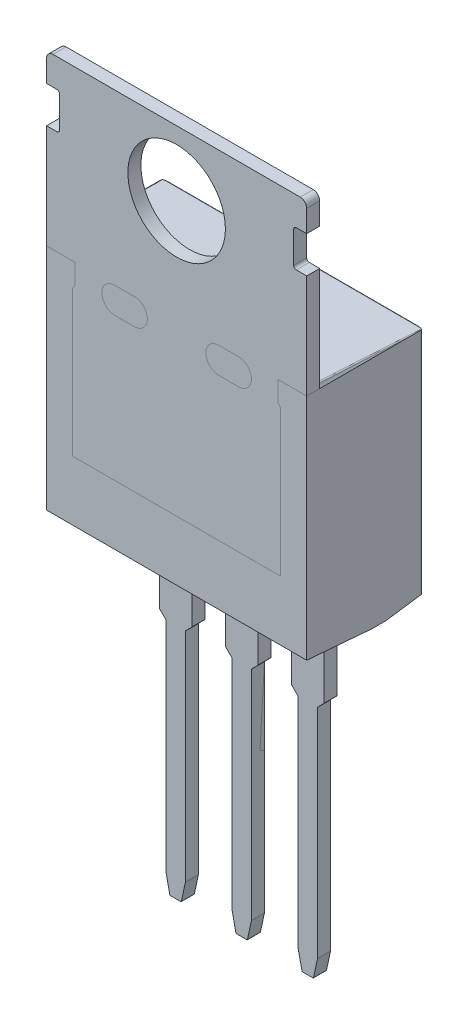
from build123d import *

# Parameters (mm, degrees)
SKETCH1_W               = 4.5
SKETCH1_H               = 9
BOSS_EXTRUDE1_DEPTH     = 5
CUT_EXTRUDE1_DEPTH      = 0.5
BOSS_EXTRUDE5_DEPTH     = 4.9
FILLET5_R               = 0.5
FILLET6_R               = 0.05
CUT_EXTRUDE2_DEPTH      = 12.25642999
CUT_EXTRUDE2_DEPTH_BACK = 12.25642999
BOSS_EXTRUDE3_DEPTH     = 0.5
FILLET2_R               = 0.02
SKETCH3_R               = 1.875
BOSS_EXTRUDE2_DEPTH     = 0.5
FILLET1_R               = 0.25
LPATTERN1_START         = -0.75
LPATTERN1_DEPTH         = 0.5
FILLET7_SIZE            = 0.5
FILLET7_SIZE_2          = 0.1
FILLET9_R               = 0.05
BOSS_EXTRUDE9_DEPTH     = 0.0005
BOSS_EXTRUDE9_2_DEPTH   = 0.0005
BOSS_EXTRUDE9_3_DEPTH   = 0.0005
BOSS_EXTRUDE9_4_DEPTH   = 0.0005
BOSS_EXTRUDE9_5_DEPTH   = 0.0005
SKETCH12_W              = 0.5
SKETCH12_H              = 1.40625
CUT_EXTRUDE3_DEPTH      = 19.403537244
FILLET10_R              = 0.1


with BuildPart() as part:
    # Sketch1 → Boss-Extrude1 (new, symmetric)
    with BuildSketch(Plane(origin=(0, 0, 0), x_dir=(0, 0, -1), z_dir=(1, 0, 0))):
        Rectangle(SKETCH1_W, SKETCH1_H)
    extrude(amount=BOSS_EXTRUDE1_DEPTH, both=True)

    # Sketch2 → Cut-Extrude1 (cut)
    with BuildSketch(Plane.XY.offset(2.25)):
        Polygon((-4, -2), (4, -2), (4, 3.589314856), (3.9, 3.738565289), (3.9, 4.5), (3.9, 5.586504107), (-3.9, 5.586504107), (-3.9, 4.5), (-3.9, 3.738565289), (-4, 3.589314856), align=None)
        with BuildLine():
            Line((-2.375, 4.5), (-1.625, 4.5))
            ThreePointArc((-1.625, 4.5), (-1.125, 4), (-1.625, 3.5))
            Line((-1.625, 3.5), (-2.375, 3.5))
            ThreePointArc((-2.375, 3.5), (-2.875, 4), (-2.375, 4.5))
        make_face(mode=Mode.SUBTRACT)
        with BuildLine():
            Line((2.375, 4.5), (1.625, 4.5))
            ThreePointArc((1.625, 4.5), (1.125, 4), (1.625, 3.5))
            Line((1.625, 3.5), (2.375, 3.5))
            ThreePointArc((2.375, 3.5), (2.875, 4), (2.375, 4.5))
        make_face(mode=Mode.SUBTRACT)
    extrude(amount=-CUT_EXTRUDE1_DEPTH, mode=Mode.SUBTRACT)

    # Sketch6 → Boss-Extrude5 (add, symmetric)
    with BuildSketch(Plane(origin=(0, 0, 0), x_dir=(0, 0, -1), z_dir=(1, 0, 0))):
        Polygon((2.25, 4.5), (-1.75, 4.652387837), (-1.75, 4.5), align=None)
    extrude(amount=BOSS_EXTRUDE5_DEPTH, both=True)

    # Fillet5
    # the kernel refuses this fillet: 0.5 mm, written as the material it adds along each edge
    with BuildSketch(Plane(origin=(-4.9, 4.5, 1.75), x_dir=(-1, 0, 0), z_dir=(0, 0, -1))) as fillet5_piece_1_section:
        with BuildLine():
            CenterArc((0.5, 0.3), FILLET5_R, 180, 36.869897646)
            Line((0, 0.3), (0, 0))
            Line((0, 0), (0.1, 0))
        make_face()
    fillet5_piece_1 = extrude(amount=4.75, mode=Mode.PRIVATE)
    fillet5_piece_1 = split(fillet5_piece_1, bisect_by=Plane(origin=(-4.9, 4.652166985, 1.744202901), z_dir=(0, -0.9992750998282863, 0.03806934282554173)), keep=Keep.TOP, mode=Mode.PRIVATE)
    add(fillet5_piece_1)
    with BuildSketch(Plane(origin=(4.9, 4.5, 1.75), x_dir=(1, 0, 0), z_dir=(0, 0, -1))) as fillet5_piece_2_section:
        with BuildLine():
            CenterArc((0.5, -0.3), FILLET5_R, 143.130102354, 36.869897646)
            Line((0, -0.3), (0, 0))
            Line((0, 0), (0.1, 0))
        make_face()
    fillet5_piece_2 = extrude(amount=4.75, mode=Mode.PRIVATE)
    fillet5_piece_2 = split(fillet5_piece_2, bisect_by=Plane(origin=(4.9, 4.652166985, 1.744202901), z_dir=(0, -0.9992750998282863, 0.03806934282554173)), keep=Keep.TOP, mode=Mode.PRIVATE)
    add(fillet5_piece_2)

    # Fillet6
    fillet6_edges = [part.edges().sort_by_distance(p)[0] for p in [
        (-4.952889184, 4.57618776, -0.250161646),
        (4.952889184, 4.57618776, -0.250161646),
    ]]
    fillet(fillet6_edges, radius=FILLET6_R)

    # Sketch7 → Cut-Extrude2 (cut, two sides: drawn at the far end of the back side and taken through both)
    with BuildSketch(Plane(origin=(5, 0, 0), x_dir=(0, 0, -1), z_dir=(1, 0, 0)).offset(-CUT_EXTRUDE2_DEPTH_BACK)):
        Polygon((0.25, -4.5), (-2.25, -4.5), (-2.25, -4.295400549), align=None)
        Polygon((2.25, -4.5), (0.8, -4.5), (2.25, -4.295400549), align=None)
    extrude(amount=CUT_EXTRUDE2_DEPTH + CUT_EXTRUDE2_DEPTH_BACK, mode=Mode.SUBTRACT)

    # LPattern1: read off the stored shape, not the designer's step
    # LPattern1 outline → LPattern1 (add)
    with BuildSketch(Plane.XY.offset(LPATTERN1_START)):
        with BuildLine():
            Line((3.208197623, -4.5), (1.871802377, -4.5))
            Line((1.871802377, -4.5), (1.871802377, -5.48))
            ThreePointArc((1.871802377, -5.48), (1.877660241, -5.494142136), (1.891802377, -5.5))
            Line((1.891802377, -5.5), (1.895, -5.5))
            ThreePointArc((1.895, -5.5), (1.909142136, -5.505857864), (1.915, -5.52))
            Line((1.915, -5.52), (1.915, -7.891715729))
            ThreePointArc((1.915, -7.891715729), (1.916522409, -7.899369397), (1.920857864, -7.905857864))
            Line((1.920857864, -7.905857864), (2.159142136, -8.144142136))
            ThreePointArc((2.159142136, -8.144142136), (2.163477591, -8.150630603), (2.165, -8.158284271))
            Line((2.165, -8.158284271), (2.165, -16.516578995))
            ThreePointArc((2.165, -16.516578995), (2.165111122, -16.51868435), (2.165443252, -16.52076631))
            Line((2.165443252, -16.52076631), (2.318194539, -17.234187315))
            ThreePointArc((2.318194539, -17.234187315), (2.325176437, -17.245552272), (2.337751287, -17.25))
            Line((2.337751287, -17.25), (2.742248713, -17.25))
            ThreePointArc((2.742248713, -17.25), (2.754823563, -17.245552272), (2.761805461, -17.234187315))
            Line((2.761805461, -17.234187315), (2.914556748, -16.52076631))
            ThreePointArc((2.914556748, -16.52076631), (2.914888878, -16.51868435), (2.915, -16.516578995))
            Line((2.915, -16.516578995), (2.915, -8.158284271))
            ThreePointArc((2.915, -8.158284271), (2.916522409, -8.150630603), (2.920857864, -8.144142136))
            Line((2.920857864, -8.144142136), (3.159142136, -7.905857864))
            ThreePointArc((3.159142136, -7.905857864), (3.163477591, -7.899369397), (3.165, -7.891715729))
            Line((3.165, -7.891715729), (3.165, -5.52))
            ThreePointArc((3.165, -5.52), (3.170857864, -5.505857864), (3.185, -5.5))
            Line((3.185, -5.5), (3.188197623, -5.5))
            ThreePointArc((3.188197623, -5.5), (3.202339759, -5.494142136), (3.208197623, -5.48))
            Line((3.208197623, -5.48), (3.208197623, -4.5))
        make_face()
        with BuildLine():
            Line((0.668197623, -4.5), (-0.668197623, -4.5))
            Line((-0.668197623, -4.5), (-0.668197623, -5.48))
            ThreePointArc((-0.668197623, -5.48), (-0.662339759, -5.494142136), (-0.648197623, -5.5))
            Line((-0.648197623, -5.5), (-0.645, -5.5))
            ThreePointArc((-0.645, -5.5), (-0.630857864, -5.505857864), (-0.625, -5.52))
            Line((-0.625, -5.52), (-0.625, -7.891715729))
            ThreePointArc((-0.625, -7.891715729), (-0.623477591, -7.899369397), (-0.619142136, -7.905857864))
            Line((-0.619142136, -7.905857864), (-0.380857864, -8.144142136))
            ThreePointArc((-0.380857864, -8.144142136), (-0.376522409, -8.150630603), (-0.375, -8.158284271))
            Line((-0.375, -8.158284271), (-0.375, -16.516578995))
            ThreePointArc((-0.375, -16.516578995), (-0.374888878, -16.51868435), (-0.374556748, -16.52076631))
            Line((-0.374556748, -16.52076631), (-0.221805461, -17.234187315))
            ThreePointArc((-0.221805461, -17.234187315), (-0.214823563, -17.245552272), (-0.202248713, -17.25))
            Line((-0.202248713, -17.25), (0.202248713, -17.25))
            ThreePointArc((0.202248713, -17.25), (0.214823563, -17.245552272), (0.221805461, -17.234187315))
            Line((0.221805461, -17.234187315), (0.374556748, -16.52076631))
            ThreePointArc((0.374556748, -16.52076631), (0.374888878, -16.51868435), (0.375, -16.516578995))
            Line((0.375, -16.516578995), (0.375, -8.158284271))
            ThreePointArc((0.375, -8.158284271), (0.376522409, -8.150630603), (0.380857864, -8.144142136))
            Line((0.380857864, -8.144142136), (0.619142136, -7.905857864))
            ThreePointArc((0.619142136, -7.905857864), (0.623477591, -7.899369397), (0.625, -7.891715729))
            Line((0.625, -7.891715729), (0.625, -5.52))
            ThreePointArc((0.625, -5.52), (0.630857864, -5.505857864), (0.645, -5.5))
            Line((0.645, -5.5), (0.648197623, -5.5))
            ThreePointArc((0.648197623, -5.5), (0.662339759, -5.494142136), (0.668197623, -5.48))
            Line((0.668197623, -5.48), (0.668197623, -4.5))
        make_face()
        with BuildLine():
            Line((-2.915, -8.158284271), (-2.915, -16.516578995))
            ThreePointArc((-2.915, -16.516578995), (-2.914888878, -16.51868435), (-2.914556748, -16.52076631))
            Line((-2.914556748, -16.52076631), (-2.761805461, -17.234187315))
            ThreePointArc((-2.761805461, -17.234187315), (-2.754823563, -17.245552272), (-2.742248713, -17.25))
            Line((-2.742248713, -17.25), (-2.337751287, -17.25))
            ThreePointArc((-2.337751287, -17.25), (-2.325176437, -17.245552272), (-2.318194539, -17.234187315))
            Line((-2.318194539, -17.234187315), (-2.165443252, -16.52076631))
            ThreePointArc((-2.165443252, -16.52076631), (-2.165111122, -16.51868435), (-2.165, -16.516578995))
            Line((-2.165, -16.516578995), (-2.165, -8.158284271))
            ThreePointArc((-2.165, -8.158284271), (-2.163477591, -8.150630603), (-2.159142136, -8.144142136))
            Line((-2.159142136, -8.144142136), (-1.920857864, -7.905857864))
            ThreePointArc((-1.920857864, -7.905857864), (-1.916522409, -7.899369397), (-1.915, -7.891715729))
            Line((-1.915, -7.891715729), (-1.915, -5.52))
            ThreePointArc((-1.915, -5.52), (-1.909142136, -5.505857864), (-1.895, -5.5))
            Line((-1.895, -5.5), (-1.891802377, -5.5))
            ThreePointArc((-1.891802377, -5.5), (-1.877660241, -5.494142136), (-1.871802377, -5.48))
            Line((-1.871802377, -5.48), (-1.871802377, -4.5))
            Line((-1.871802377, -4.5), (-3.208197623, -4.5))
            Line((-3.208197623, -4.5), (-3.208197623, -5.48))
            ThreePointArc((-3.208197623, -5.48), (-3.202339759, -5.494142136), (-3.188197623, -5.5))
            Line((-3.188197623, -5.5), (-3.185, -5.5))
            ThreePointArc((-3.185, -5.5), (-3.170857864, -5.505857864), (-3.165, -5.52))
            Line((-3.165, -5.52), (-3.165, -7.891715729))
            ThreePointArc((-3.165, -7.891715729), (-3.163477591, -7.899369397), (-3.159142136, -7.905857864))
            Line((-3.159142136, -7.905857864), (-2.920857864, -8.144142136))
            ThreePointArc((-2.920857864, -8.144142136), (-2.916522409, -8.150630603), (-2.915, -8.158284271))
        make_face()
    extrude(amount=LPATTERN1_DEPTH)

    # Fillet7
    # a fillet whose section is not a circle: 0.5, 0.1 mm, written as the material it takes off along each edge
    with BuildSketch(Plane(origin=(-5, -5.545400549, -2.25), x_dir=(1, 0, 0), z_dir=(0, 1, 0))) as fillet7_piece_1:
        with BuildLine():
            Bezier((FILLET7_SIZE, 0), (0, 0), (0, -FILLET7_SIZE_2), weights=[1, 0.707106781, 1])
            Line((0, -FILLET7_SIZE_2), (0, 0))
            Line((0, 0), (FILLET7_SIZE, 0))
        make_face()
    extrude(amount=11.289108142, mode=Mode.SUBTRACT)
    with BuildSketch(Plane(origin=(5, -5.545400549, -2.25), x_dir=(0, 0, 1), z_dir=(0, 1, 0))) as fillet7_piece_2:
        with BuildLine():
            Bezier((FILLET7_SIZE_2, 0), (0, 0), (0, -FILLET7_SIZE), weights=[1, 0.707106781, 1])
            Line((0, -FILLET7_SIZE), (0, 0))
            Line((0, 0), (FILLET7_SIZE_2, 0))
        make_face()
    extrude(amount=11.289108142, mode=Mode.SUBTRACT)

    # Fillet9
    # the kernel refuses this fillet: 0.05 mm, written as the material it takes off along each edge
    with BuildSketch(Plane(origin=(5.101642792, 4.5, -2.25), x_dir=(2.542151763486406e-12, 0.03806934280621304, 0.9992750998290226), z_dir=(-1.0, 0, 2.543958310001694e-12))) as fillet9_piece_1:
        with BuildLine():
            CenterArc((FILLET9_R * 0.962628466484, -FILLET9_R), FILLET9_R, 90.000000001, 87.818260121)
            Line((-FILLET9_R * 0.0366466333446, -FILLET9_R * 0.961930657194), (0, 0))
            Line((0, 0), (FILLET9_R * 0.962628466465, 0))
        make_face()
    extrude(amount=10.203285583, mode=Mode.SUBTRACT)


with BuildPart() as body_2:
    # Sketch4 → Boss-Extrude3 (new body)
    with BuildSketch(Plane(origin=(0, 0, -0.25), x_dir=(-1, 0, 0), z_dir=(0, 0, -1))):
        Polygon((-0.668197623, -4.5), (0.668197623, -4.5), (0.668197623, -5.5), (0.625, -5.5), (0.625, -7.9), (0.375, -8.15), (0.375, -16.518696112), (0.218419791, -17.25), (-0.218419791, -17.25), (-0.375, -16.518696112), (-0.375, -8.15), (-0.625, -7.9), (-0.625, -5.5), (-0.668197623, -5.5), align=None)
    extrude(amount=BOSS_EXTRUDE3_DEPTH)

    # Fillet2
    fillet2_edges = [body_2.edges().sort_by_distance(p)[0] for p in [
        (-0.375, -16.518696112, -0.5),
        (-0.218419791, -17.25, -0.5),
        (0.218419791, -17.25, -0.5),
        (0.375, -16.518696112, -0.5),
        (0.375, -8.15, -0.5),
        (0.625, -7.9, -0.5),
        (0.625, -5.5, -0.5),
        (0.668197623, -5.5, -0.5),
        (-0.668197623, -5.5, -0.5),
        (-0.625, -5.5, -0.5),
        (-0.625, -7.9, -0.5),
        (-0.375, -8.15, -0.5),
    ]]
    fillet(fillet2_edges, radius=FILLET2_R)


with BuildPart() as body_3:
    # Sketch3 → Boss-Extrude2 (new body)
    with BuildSketch(Plane.XY.offset(1.75)):
        Polygon((-5, 4.5), (-5, 11), (5, 11), (5, 4.5), (3.9, 4.5), (3.9, 3.738565289), (4, 3.589314856), (4, -2), (-4, -2), (-4, 3.589314856), (-3.9, 3.738565289), (-3.9, 4.5), align=None)
        with Locations((0, 8.5)):
            Circle(SKETCH3_R, mode=Mode.SUBTRACT)
        with BuildLine():
            Line((2.375, 4.5), (1.625, 4.5))
            ThreePointArc((1.625, 4.5), (1.125, 4), (1.625, 3.5))
            Line((1.625, 3.5), (2.375, 3.5))
            ThreePointArc((2.375, 3.5), (2.875, 4), (2.375, 4.5))
        make_face(mode=Mode.SUBTRACT)
        with BuildLine():
            Line((-2.375, 3.5), (-1.625, 3.5))
            ThreePointArc((-1.625, 3.5), (-1.125, 4), (-1.625, 4.5))
            Line((-1.625, 4.5), (-2.375, 4.5))
            ThreePointArc((-2.375, 4.5), (-2.875, 4), (-2.375, 3.5))
        make_face(mode=Mode.SUBTRACT)
    extrude(amount=BOSS_EXTRUDE2_DEPTH)

    # Fillet1
    fillet1_edges = [body_3.edges().sort_by_distance(p)[0] for p in [
        (-5, 11, 2),
        (5, 11, 2),
    ]]
    fillet(fillet1_edges, radius=FILLET1_R)

    # Sketch12 → Cut-Extrude3 (cut, through all)
    with BuildSketch(Plane(origin=(0, 0, 1.75), x_dir=(-1, 0, 0), z_dir=(0, 0, -1))):
        with Locations((4.75, 9.203125)):
            Rectangle(SKETCH12_W, SKETCH12_H)
        with Locations((-4.75, 9.203125)):
            Rectangle(SKETCH12_W, SKETCH12_H)
    extrude(amount=-CUT_EXTRUDE3_DEPTH, mode=Mode.SUBTRACT)

    # Fillet10
    fillet10_edges = [body_3.edges().sort_by_distance(p)[0] for p in [
        (4.5, 9.90625, 2),
        (4.5, 8.5, 2),
        (-4.5, 8.5, 2),
        (-4.5, 9.90625, 2),
    ]]
    fillet(fillet10_edges, radius=FILLET10_R)


with BuildPart() as body_4:
    # Sketch11 → Boss-Extrude9 (new body)
    with BuildSketch(Plane(origin=(0, 0, -2.25), x_dir=(-1, 0, 0), z_dir=(0, 0, -1))):
        Polygon((-3.723080955, -1.488315738), (-3.723080955, 0.052675473), (-3.505761682, 0.052675473), (-3.505761682, -1.31050906), (-2.774778672, -1.31050906), (-2.774778672, -1.488315738), align=None)
    extrude(amount=BOSS_EXTRUDE9_DEPTH)


with BuildPart() as body_5:
    # Sketch11 → Boss-Extrude9 2 (new body)
    with BuildSketch(Plane(origin=(0, 0, -2.25), x_dir=(-1, 0, 0), z_dir=(0, 0, -1))):
        with BuildLine():
            Line((-2.292725011, -1.488315738), (-2.292725011, 0.052675473))
            Line((-2.292725011, 0.052675473), (-1.965820024, 0.052675473))
            Line((-1.965820024, 0.052675473), (-1.621319585, -1.028673127))
            add(Edge.make_bspline(
                [(-1.621319585, -1.028673127), (-1.617528343, -1.040922922), (-1.610196302, -1.064613313), (-1.599323755, -1.098824417), (-1.58943156, -1.13061597), (-1.58052208, -1.160089165), (-1.572114089, -1.187097671), (-1.564834094, -1.211863111), (-1.557874181, -1.234110287), (-1.553795361, -1.248249094), (-1.551863852, -1.254944473)],
                knots=[0, 0, 0, 0, 1.300204174, 2.514519184, 3.639827924, 4.676153899, 5.636536826, 6.507959918, 7.293450077, 8, 8, 8, 8], degree=3))
            add(Edge.make_bspline(
                [(-1.551863852, -1.254944473), (-1.549712599, -1.247635881), (-1.545134594, -1.232082732), (-1.537712917, -1.20762807), (-1.529816042, -1.180566235), (-1.520365903, -1.151362376), (-1.510515251, -1.119558375), (-1.50017571, -1.085180645), (-1.48824925, -1.048572407), (-1.480323522, -1.023227961), (-1.476234275, -1.010151598)],
                knots=[0, 0, 0, 0, 0.713638162, 1.518667645, 2.393860736, 3.354087503, 4.393659122, 5.512594909, 6.716633584, 8, 8, 8, 8], degree=3))
            Line((-1.476234275, -1.010151598), (-1.13512945, 0.052675473))
            Line((-1.13512945, 0.052675473), (-0.811002693, 0.052675473))
            Line((-0.811002693, 0.052675473), (-0.811002693, -1.488315738))
            Line((-0.811002693, -1.488315738), (-1.028321966, -1.488315738))
            Line((-1.028321966, -1.488315738), (-1.028321966, -0.184400098))
            Line((-1.028321966, -0.184400098), (-1.439499909, -1.488315738))
            Line((-1.439499909, -1.488315738), (-1.666697331, -1.488315738))
            Line((-1.666697331, -1.488315738), (-2.075405738, -0.184400098))
            Line((-2.075405738, -0.184400098), (-2.075405738, -1.488315738))
            Line((-2.075405738, -1.488315738), (-2.292725011, -1.488315738))
        make_face()
    extrude(amount=BOSS_EXTRUDE9_2_DEPTH)


with BuildPart() as body_6:
    # Sketch11 → Boss-Extrude9 3 (new body)
    with BuildSketch(Plane(origin=(0, 0, -2.25), x_dir=(-1, 0, 0), z_dir=(0, 0, -1))):
        with BuildLine():
            Line((-0.289436437, -1.073433489), (-0.091873461, -1.053677191))
            add(Edge.make_bspline(
                [(-0.091873461, -1.053677191), (-0.08923971, -1.065547945), (-0.084143597, -1.088516972), (-0.074338053, -1.121422491), (-0.063981246, -1.15196617), (-0.051141972, -1.179464821), (-0.038613631, -1.205043025), (-0.023890934, -1.227643915), (-0.008159446, -1.247857177), (0.008871656, -1.265607756), (0.027398623, -1.280893172), (0.04717445, -1.294268736), (0.068617378, -1.305439133), (0.091563235, -1.314283364), (0.115818762, -1.321442845), (0.141515774, -1.326699922), (0.168790154, -1.329831628), (0.187484528, -1.330118422), (0.197062391, -1.330265357)],
                knots=[0, 0, 0, 0, 1.321063709, 2.556160278, 3.730472002, 4.821700466, 5.852032229, 6.822994757, 7.746964065, 8.632786469, 9.490489437, 10.352773447, 11.223141997, 12.11199479, 13.021433979, 13.96892724, 14.959401504, 16, 16, 16, 16], degree=3))
            add(Edge.make_bspline(
                [(0.197062391, -1.330265357), (0.208296885, -1.330105181), (0.23023787, -1.329792355), (0.262209504, -1.325098781), (0.292636152, -1.318654056), (0.321083706, -1.308548359), (0.347948282, -1.296197328), (0.373076833, -1.280934075), (0.396641361, -1.263011196), (0.418177072, -1.242306778), (0.437436406, -1.219531258), (0.454589549, -1.195474497), (0.468772893, -1.169931225), (0.480727316, -1.143261226), (0.489551244, -1.115033526), (0.496011072, -1.08560011), (0.500232602, -1.054827869), (0.500618512, -1.033832135), (0.500815466, -1.023116668)],
                knots=[0, 0, 0, 0, 1.111377895, 2.170522867, 3.193923215, 4.186422864, 5.152846954, 6.117443035, 7.091571248, 8.078879332, 9.069127402, 10.041602243, 10.999610288, 11.957618333, 12.930786866, 13.922135183, 14.939532534, 16, 16, 16, 16], degree=3))
            add(Edge.make_bspline(
                [(0.500815466, -1.023116668), (0.500583987, -1.012919265), (0.500131116, -0.992968858), (0.496408152, -0.963685941), (0.489911661, -0.935888555), (0.480905973, -0.909415825), (0.469398551, -0.884306617), (0.455566969, -0.860353299), (0.43864981, -0.838080811), (0.419608056, -0.817249926), (0.398839057, -0.798058704), (0.376110579, -0.7817341), (0.352191677, -0.767645434), (0.326797294, -0.756269388), (0.300032868, -0.747240155), (0.271923913, -0.740750668), (0.242335289, -0.737026088), (0.222179885, -0.736573138), (0.211879614, -0.736341661)],
                knots=[0, 0, 0, 0, 1.072815875, 2.098878726, 3.09954706, 4.07199174, 5.036203424, 6.001873089, 6.97636515, 7.972747947, 8.969130744, 9.945905975, 10.911575641, 11.885646534, 12.868345115, 13.879560892, 14.916365174, 16, 16, 16, 16], degree=3))
            add(Edge.make_bspline(
                [(0.211879614, -0.736341661), (0.202810851, -0.736581921), (0.183564822, -0.737091809), (0.153188148, -0.741593927), (0.119540836, -0.747897947), (0.096289582, -0.754084407), (0.084081064, -0.757332727)],
                knots=[0, 0, 0, 0, 0.837610211, 1.777604146, 2.833088267, 4, 4, 4, 4], degree=3))
            Line((0.084081064, -0.757332727), (0.104454746, -0.579526049))
            add(Edge.make_bspline(
                [(0.104454746, -0.579526049), (0.109800324, -0.580110175), (0.11924412, -0.581142124), (0.128735539, -0.58152203), (0.132854424, -0.581686894)],
                knots=[0, 0, 0, 0, 1.132082448, 2, 2, 2, 2], degree=3))
            add(Edge.make_bspline(
                [(0.132854424, -0.581686894), (0.151023675, -0.580993199), (0.186666035, -0.579632388), (0.238625687, -0.568325183), (0.287868197, -0.550522355), (0.325911218, -0.529280998), (0.354122636, -0.509302348), (0.371912189, -0.491288761), (0.387950389, -0.472172706), (0.399916197, -0.450245899), (0.410253917, -0.426948136), (0.416655527, -0.401361658), (0.421324104, -0.374108405), (0.421632095, -0.355232062), (0.421790276, -0.3455374)],
                knots=[0, 0, 0, 0, 1.557468908, 3.055264441, 4.54122591, 6.035034992, 6.780215604, 7.498173296, 8.201377046, 8.913174237, 9.633083494, 10.382644491, 11.169345745, 12, 12, 12, 12], degree=3))
            add(Edge.make_bspline(
                [(0.421790276, -0.3455374), (0.421644287, -0.337706695), (0.421358773, -0.322392044), (0.418178023, -0.299939149), (0.412917452, -0.27866434), (0.405807268, -0.258340459), (0.396488666, -0.239074022), (0.384932867, -0.220888615), (0.371729975, -0.203415331), (0.356144428, -0.187557076), (0.33945366, -0.17266853), (0.321049026, -0.16012932), (0.30180645, -0.148990076), (0.281047289, -0.140572669), (0.259284039, -0.133652188), (0.236330665, -0.128802595), (0.212178788, -0.125545769), (0.195633015, -0.125271338), (0.187184242, -0.125131205)],
                knots=[0, 0, 0, 0, 1.041493611, 2.036867705, 3.009952345, 3.954088258, 4.897230656, 5.850851638, 6.817653571, 7.805463921, 8.805067469, 9.788883576, 10.763797054, 11.758134544, 12.762883247, 13.799594994, 14.876406454, 16, 16, 16, 16], degree=3))
            add(Edge.make_bspline(
                [(0.187184242, -0.125131205), (0.170650207, -0.125775894), (0.138720533, -0.127020885), (0.093006317, -0.138539631), (0.051580982, -0.15717846), (0.020911662, -0.179036603), (-0.000866252, -0.199934225), (-0.015741721, -0.217647369), (-0.029046985, -0.237207846), (-0.040819754, -0.258608683), (-0.050900973, -0.281935947), (-0.059988913, -0.306900647), (-0.067023822, -0.33390247), (-0.070390602, -0.352612071), (-0.072117163, -0.362206776)],
                knots=[0, 0, 0, 0, 1.533565899, 2.961543033, 4.347411787, 5.731829577, 6.434842101, 7.147085226, 7.87612511, 8.629021686, 9.412189982, 10.234506416, 11.094615066, 12, 12, 12, 12], degree=3))
            Line((-0.072117163, -0.362206776), (-0.269680139, -0.342450478))
            add(Edge.make_bspline(
                [(-0.269680139, -0.342450478), (-0.266589664, -0.327174694), (-0.260527455, -0.297210041), (-0.248176761, -0.253932916), (-0.233115241, -0.21330802), (-0.215031356, -0.175521609), (-0.194779446, -0.14012147), (-0.171417398, -0.107527503), (-0.145492937, -0.077545932), (-0.116960012, -0.050268206), (-0.086205977, -0.025906146), (-0.053385729, -0.004890672), (-0.018768614, 0.012922971), (0.01767778, 0.027283918), (0.055924596, 0.038961544), (0.096080644, 0.046698001), (0.137964164, 0.051931324), (0.166485135, 0.052424372), (0.181010399, 0.052675473)],
                knots=[0, 0, 0, 0, 1.136581168, 2.229493434, 3.279335563, 4.293305329, 5.282068175, 6.250623624, 7.213783178, 8.169396253, 9.125981663, 10.071280146, 11.007896369, 11.961295906, 12.925420184, 13.920544621, 14.940967302, 16, 16, 16, 16], degree=3))
            add(Edge.make_bspline(
                [(0.181010399, 0.052675473), (0.201116824, 0.052023471), (0.240652554, 0.050741425), (0.298721329, 0.040559257), (0.354263807, 0.023850116), (0.406833041, 0.000688267), (0.455524605, -0.027614901), (0.498612625, -0.061534524), (0.535521074, -0.1004838), (0.565533086, -0.144036901), (0.58929839, -0.190407939), (0.606884, -0.238543087), (0.617391666, -0.288386934), (0.61869806, -0.322131206), (0.619353252, -0.339054865)],
                knots=[0, 0, 0, 0, 1.104647871, 2.172094857, 3.229560912, 4.285649672, 5.322588163, 6.317201348, 7.289435229, 8.260615662, 9.214246199, 10.146367077, 11.070353327, 12, 12, 12, 12], degree=3))
            add(Edge.make_bspline(
                [(0.619353252, -0.339054865), (0.618689018, -0.355052747), (0.617377521, -0.386639799), (0.607280543, -0.432825665), (0.590218658, -0.476581579), (0.567157397, -0.518061062), (0.537252598, -0.556367086), (0.500586403, -0.590501244), (0.457745374, -0.62079015), (0.425639645, -0.636555191), (0.409133898, -0.644660093)],
                knots=[0, 0, 0, 0, 0.975609618, 1.926294443, 2.868398979, 3.832526731, 4.812148358, 5.820404151, 6.879456693, 8, 8, 8, 8], degree=3))
            add(Edge.make_bspline(
                [(0.409133898, -0.644660093), (0.4201999, -0.64745404), (0.441874969, -0.652926566), (0.473005284, -0.664265485), (0.502271274, -0.677540507), (0.530062452, -0.692576032), (0.555571987, -0.710357978), (0.579679171, -0.729800519), (0.601472696, -0.751840023), (0.621583959, -0.775690962), (0.63988274, -0.801103733), (0.655281343, -0.82857267), (0.66856989, -0.857375664), (0.679901099, -0.887721622), (0.688043681, -0.919844535), (0.693865884, -0.953495544), (0.697708063, -0.988557737), (0.698152792, -1.012508049), (0.698378442, -1.024660129)],
                knots=[0, 0, 0, 0, 1.053251915, 2.063013066, 3.05373318, 4.018979697, 4.975584284, 5.920798056, 6.874756953, 7.832116109, 8.799604348, 9.761196922, 10.734637845, 11.72654167, 12.747371341, 13.789206138, 14.878271633, 16, 16, 16, 16], degree=3))
            add(Edge.make_bspline(
                [(0.698378442, -1.024660129), (0.698002428, -1.041250641), (0.69726344, -1.073856322), (0.690257807, -1.121754809), (0.678809031, -1.167647998), (0.662965461, -1.211691736), (0.642889151, -1.254065771), (0.617696693, -1.294172135), (0.588134734, -1.332336837), (0.554665434, -1.368194465), (0.517996613, -1.401148728), (0.478175676, -1.42968397), (0.435990478, -1.453916547), (0.391372369, -1.473678093), (0.34443963, -1.489203836), (0.295145573, -1.500333184), (0.243337659, -1.506874016), (0.207988342, -1.50766744), (0.189962472, -1.508072035)],
                knots=[0, 0, 0, 0, 1.016055063, 1.996874249, 2.958724482, 3.910019225, 4.860394196, 5.826121543, 6.806008102, 7.814207964, 8.82789325, 9.821757317, 10.810247154, 11.803791187, 12.806673825, 13.834534493, 14.895752369, 16, 16, 16, 16], degree=3))
            add(Edge.make_bspline(
                [(0.189962472, -1.508072035), (0.173785749, -1.507767332), (0.141939279, -1.507167474), (0.095322623, -1.500917974), (0.050661442, -1.492049216), (0.008308894, -1.47837696), (-0.032226985, -1.461703864), (-0.070259664, -1.440373154), (-0.106472999, -1.415886325), (-0.140187131, -1.387543783), (-0.171214826, -1.356261024), (-0.198895242, -1.322500749), (-0.222664603, -1.286337914), (-0.243621954, -1.248313586), (-0.260560914, -1.207710985), (-0.273750576, -1.164878713), (-0.28380787, -1.119975732), (-0.287539834, -1.089116371), (-0.289436437, -1.073433489)],
                knots=[0, 0, 0, 0, 1.08471039, 2.135426191, 3.150939737, 4.135689946, 5.116584603, 6.086901885, 7.055842759, 8.045878862, 9.036901429, 10.008421467, 10.96965771, 11.936653536, 12.917548193, 13.915472582, 14.940632654, 16, 16, 16, 16], degree=3))
        make_face()
    extrude(amount=BOSS_EXTRUDE9_3_DEPTH)


with BuildPart() as body_7:
    # Sketch11 → Boss-Extrude9 4 (new body)
    with BuildSketch(Plane(origin=(0, 0, -2.25), x_dir=(-1, 0, 0), z_dir=(0, 0, -1))):
        with BuildLine():
            Line((1.871902518, -1.488315738), (1.674339542, -1.488315738))
            Line((1.674339542, -1.488315738), (1.674339542, -0.287503276))
            add(Edge.make_bspline(
                [(1.674339542, -0.287503276), (1.662963849, -0.298473733), (1.639320716, -0.321274625), (1.599354498, -0.353543582), (1.554747092, -0.386249537), (1.506077751, -0.417699969), (1.456467593, -0.447307159), (1.408525761, -0.473934275), (1.363052666, -0.496467276), (1.333099293, -0.50878841), (1.318726186, -0.514700698)],
                knots=[0, 0, 0, 0, 0.893362401, 1.856755847, 2.901947673, 4.020460078, 5.132200827, 6.168787962, 7.121294059, 8, 8, 8, 8], degree=3))
            Line((1.318726186, -0.514700698), (1.318726186, -0.33257233))
            add(Edge.make_bspline(
                [(1.318726186, -0.33257233), (1.343413483, -0.319858322), (1.392070683, -0.294799767), (1.460812786, -0.251520196), (1.524990934, -0.20460336), (1.583542723, -0.154059646), (1.636030672, -0.102394897), (1.680263029, -0.050263136), (1.71727385, 0.000424712), (1.73584288, 0.035773865), (1.744721352, 0.052675473)],
                knots=[0, 0, 0, 0, 1.141258006, 2.249351951, 3.335817539, 4.406819942, 5.426913362, 6.360259544, 7.215985427, 8, 8, 8, 8], degree=3))
            Line((1.744721352, 0.052675473), (1.871902518, 0.052675473))
            Line((1.871902518, 0.052675473), (1.871902518, -1.488315738))
        make_face()
    extrude(amount=BOSS_EXTRUDE9_4_DEPTH)


with BuildPart() as body_8:
    # Sketch11 → Boss-Extrude9 5 (new body)
    with BuildSketch(Plane(origin=(0, 0, -2.25), x_dir=(-1, 0, 0), z_dir=(0, 0, -1))):
        with BuildLine():
            Line((2.650300643, -0.1646438), (2.650300643, 0.032919176))
            Line((2.650300643, 0.032919176), (3.638115521, 0.032919176))
            Line((3.638115521, 0.032919176), (3.638115521, -0.126983358))
            add(Edge.make_bspline(
                [(3.638115521, -0.126983358), (3.626486362, -0.140582687), (3.602708817, -0.168388538), (3.568262187, -0.212678794), (3.533636565, -0.259832803), (3.49944057, -0.310303999), (3.465163243, -0.363724044), (3.43094254, -0.42026355), (3.396638759, -0.479784804), (3.351642468, -0.563126161), (3.297959572, -0.66982411), (3.242177946, -0.801295184), (3.192656755, -0.934076642), (3.166303824, -1.024380795), (3.153160154, -1.069420491)],
                knots=[0, 0, 0, 0, 0.603281671, 1.233499104, 1.891379699, 2.575603978, 3.288773649, 4.031381703, 4.80386477, 5.604951941, 7.224880277, 8.828980706, 10.418436603, 12, 12, 12, 12], degree=3))
            add(Edge.make_bspline(
                [(3.153160154, -1.069420491), (3.144635927, -1.101948195), (3.127294483, -1.168121624), (3.108310943, -1.270880579), (3.093633852, -1.378022269), (3.087870428, -1.451132407), (3.084939189, -1.488315738)],
                knots=[0, 0, 0, 0, 0.948866074, 1.930345965, 2.947387709, 4, 4, 4, 4], degree=3))
            Line((3.084939189, -1.488315738), (2.887376214, -1.488315738))
            add(Edge.make_bspline(
                [(2.887376214, -1.488315738), (2.88785008, -1.472975951), (2.888824559, -1.441430582), (2.893133782, -1.392957766), (2.898873274, -1.342076225), (2.906979819, -1.288957848), (2.917283904, -1.233494812), (2.929562569, -1.175628368), (2.944226888, -1.115478197), (2.965914579, -1.032083932), (2.998124326, -0.927222524), (3.045019384, -0.803233526), (3.09894997, -0.681372183), (3.150422533, -0.582549089), (3.194316037, -0.505593549), (3.227625121, -0.449756371), (3.261881407, -0.396549724), (3.29644981, -0.345590853), (3.331336323, -0.296836844), (3.367251602, -0.250743416), (3.40313674, -0.206384556), (3.428190601, -0.178434681), (3.440552546, -0.1646438)],
                knots=[0, 0, 0, 0, 0.630312875, 1.296201307, 1.998242258, 2.7335219, 3.502880474, 4.315318118, 5.163159648, 6.045885937, 7.85484959, 9.666009448, 11.488277305, 13.325849397, 14.240191093, 15.127469759, 15.996293014, 16.839220888, 17.656853801, 18.458354243, 19.239329216, 20, 20, 20, 20], degree=3))
            Line((3.440552546, -0.1646438), (2.650300643, -0.1646438))
        make_face()
    extrude(amount=BOSS_EXTRUDE9_5_DEPTH)


solid = Compound([part.part, body_2.part, body_3.part, body_4.part, body_5.part, body_6.part, body_7.part, body_8.part])
